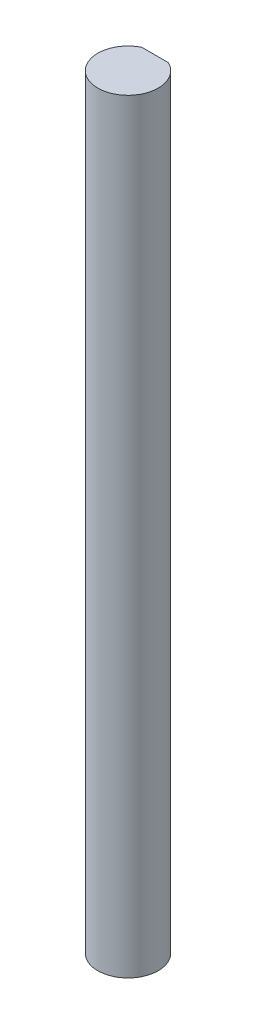
from build123d import *

# Parameters (mm, degrees)
BOSS_EXTRUDE1_DEPTH = 60


with BuildPart() as part:
    # Sketch1 → Boss-Extrude1 (new body)
    with BuildSketch(Plane(origin=(0, 0, 0), x_dir=(1, 0, 0), z_dir=(0, 1, 0))):
        with BuildLine():
            Line((-1.046432694, 2.128330957), (1.046432694, 2.128330957))
            ThreePointArc((1.046432694, 2.128330957), (0, -2.371669043), (-1.046432694, 2.128330957))
        make_face()
    extrude(amount=BOSS_EXTRUDE1_DEPTH)


solid = part.part
